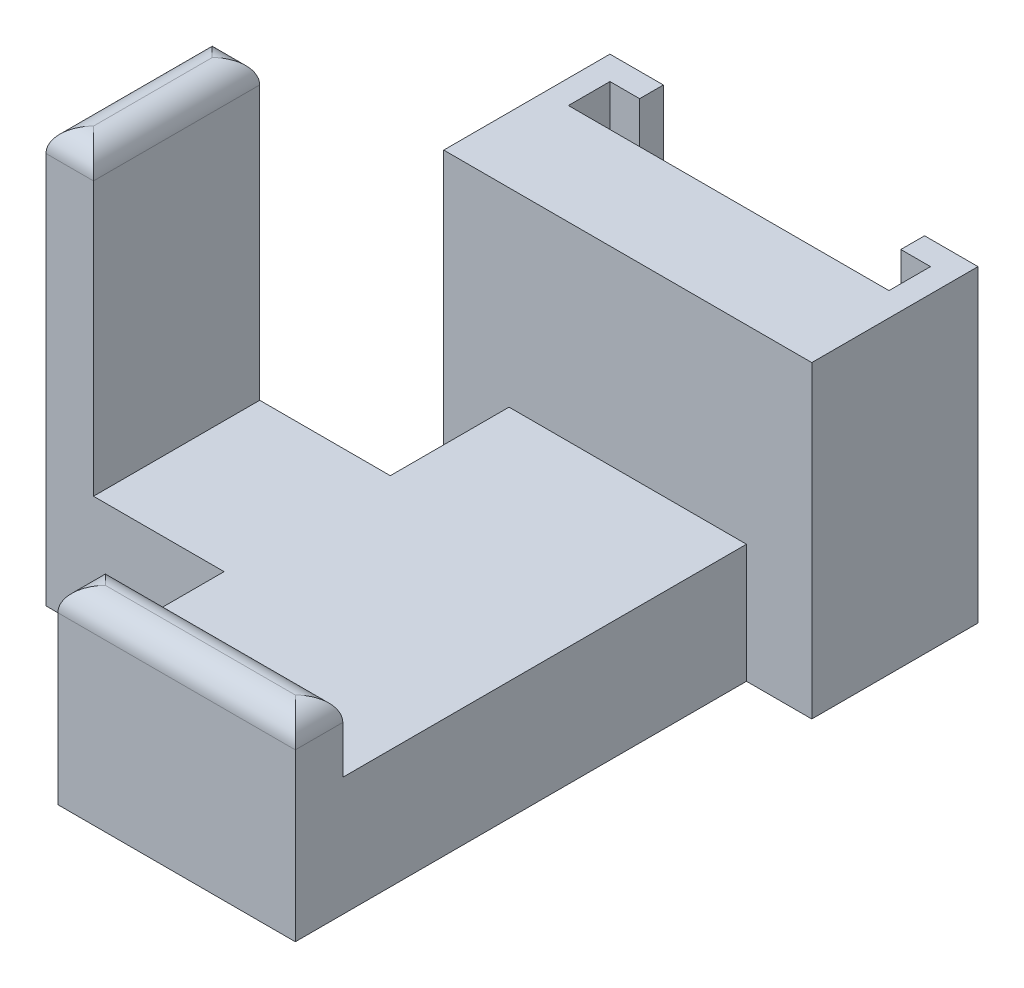
from build123d import *

# Parameters (mm, degrees)
RESSALTO_EXTRUS_O1_DEPTH       = 10
ESBO_O2_W                      = 4
ESBO_O2_H                      = 14
ESBO_O2_W_2                    = 20
ESBO_O2_H_2                    = 4
RESSALTO_EXTRUS_O2_DEPTH       = 25
ESBO_O5_W                      = 20
ESBO_O5_H                      = 42
CORTE_EXTRUS_O1_DEPTH          = 19
FILETE4_R                      = 2
RESSALTO_EXTRUS_O3_DEPTH       = 10
RESSALTO_EXTRUS_O3_DEPTH_BACK  = 4
ESBO_O8_W                      = 31
ESBO_O8_H                      = 4
FURO_DE_DI_METRO_4_0_4_1_D     = 4
FURO_DE_DI_METRO_4_0_4_1_DEPTH = 4
FURO_DE_DI_METRO_4_0_4_1_TIP   = 1.201721238
ESBO_O9_W                      = 27
ESBO_O9_H                      = 3.5
RESSALTO_EXTRUS_O4_DEPTH       = 22
ESBO_O10_W                     = 20
ESBO_O10_H                     = 4
RESSALTO_EXTRUS_O5_DEPTH       = 16
ESBO_O11_W                     = 22
ESBO_O11_H                     = 12
CORTE_EXTRUS_O2_DEPTH          = 2


with BuildPart() as part:
    # Esboço1 → Ressalto-extrusão1 (new body)
    with BuildSketch(Plane(origin=(0, 0, 0), x_dir=(1, 0, 0), z_dir=(0, 1, 0))):
        Polygon((0, 28), (-15, 28), (-15, 14), (0, 14), (0, 0), (20, 0), (20, 42), (0, 42), align=None)
    extrude(amount=RESSALTO_EXTRUS_O1_DEPTH)

    # Esboço2 → Ressalto-extrusão2 (add)
    with BuildSketch(Plane(origin=(0, 10, 0), x_dir=(1, 0, 0), z_dir=(0, 1, 0))):
        with Locations((-13, 21)):
            Rectangle(ESBO_O2_W, ESBO_O2_H)
        with Locations((10, 2)):
            Rectangle(ESBO_O2_W_2, ESBO_O2_H_2)
    extrude(amount=RESSALTO_EXTRUS_O2_DEPTH)

    # Esboço5 → Corte-extrusão1 (cut)
    with BuildSketch(Plane(origin=(0, 35, 0), x_dir=(1, 0, 0), z_dir=(0, 1, 0))):
        with Locations((10, 21)):
            Rectangle(ESBO_O5_W, ESBO_O5_H)
    extrude(amount=-CORTE_EXTRUS_O1_DEPTH, mode=Mode.SUBTRACT)

    # Filete4
    filete4_edges = [part.edges().sort_by_distance(p)[0] for p in [
        (-15, 35, -21),
        (-13, 35, -14),
        (-11, 35, -21),
        (-13, 35, -28),
        (10, 16, -4),
        (20, 16, -2),
        (10, 16, 0),
        (0, 16, -2),
    ]]
    fillet(filete4_edges, radius=FILETE4_R - 0.0001)  # a hair under: the kernel refuses the full size

    # Esboço8 → Ressalto-extrusão3 (add, two sides: drawn at the far end of the back side and taken through both)
    with BuildSketch(Plane(origin=(0, 0, -42), x_dir=(-1, 0, 0), z_dir=(0, 0, -1)).offset(-RESSALTO_EXTRUS_O3_DEPTH_BACK)):
        with Locations((-10, 2)):
            Rectangle(ESBO_O8_W, ESBO_O8_H)
    extrude(amount=RESSALTO_EXTRUS_O3_DEPTH + RESSALTO_EXTRUS_O3_DEPTH_BACK)

    # Furo de diâmetro Ø4.0 (4)1
    with Locations(Plane(origin=(-7.5, 0, -21), x_dir=(0, 0, -1), z_dir=(0, -1, 0))):
        with Locations((0, 0), (-15, 15)):
            Hole(FURO_DE_DI_METRO_4_0_4_1_D / 2, depth=FURO_DE_DI_METRO_4_0_4_1_DEPTH)
            with Locations((0, 0, -(FURO_DE_DI_METRO_4_0_4_1_DEPTH + FURO_DE_DI_METRO_4_0_4_1_TIP / 2))):  # 118° drill point
                Cone(0, FURO_DE_DI_METRO_4_0_4_1_D / 2, FURO_DE_DI_METRO_4_0_4_1_TIP, mode=Mode.SUBTRACT)

    # Esboço9 → Ressalto-extrusão4 (add)
    with BuildSketch(Plane(origin=(0, 4, 0), x_dir=(1, 0, 0), z_dir=(0, 1, 0))):
        Polygon((20, 42), (20, 38), (25.5, 38), (25.5, 52), (-5.5, 52), (-5.5, 38), (0, 38), (0, 42), align=None)
        with Locations((10, 48.25)):
            Rectangle(ESBO_O9_W, ESBO_O9_H, mode=Mode.SUBTRACT)
    extrude(amount=RESSALTO_EXTRUS_O4_DEPTH)

    # Esboço10 → Ressalto-extrusão5 (add)
    with BuildSketch(Plane(origin=(0, 10, 0), x_dir=(1, 0, 0), z_dir=(0, 1, 0))):
        with Locations((10, 40)):
            Rectangle(ESBO_O10_W, ESBO_O10_H)
    extrude(amount=RESSALTO_EXTRUS_O5_DEPTH)

    # Esboço11 → Corte-extrusão2 (cut)
    with BuildSketch(Plane(origin=(0, 0, -52), x_dir=(-1, 0, 0), z_dir=(0, 0, -1))):
        with Locations((-10, 20)):
            Rectangle(ESBO_O11_W, ESBO_O11_H)
    extrude(amount=-CORTE_EXTRUS_O2_DEPTH, mode=Mode.SUBTRACT)


solid = part.part
